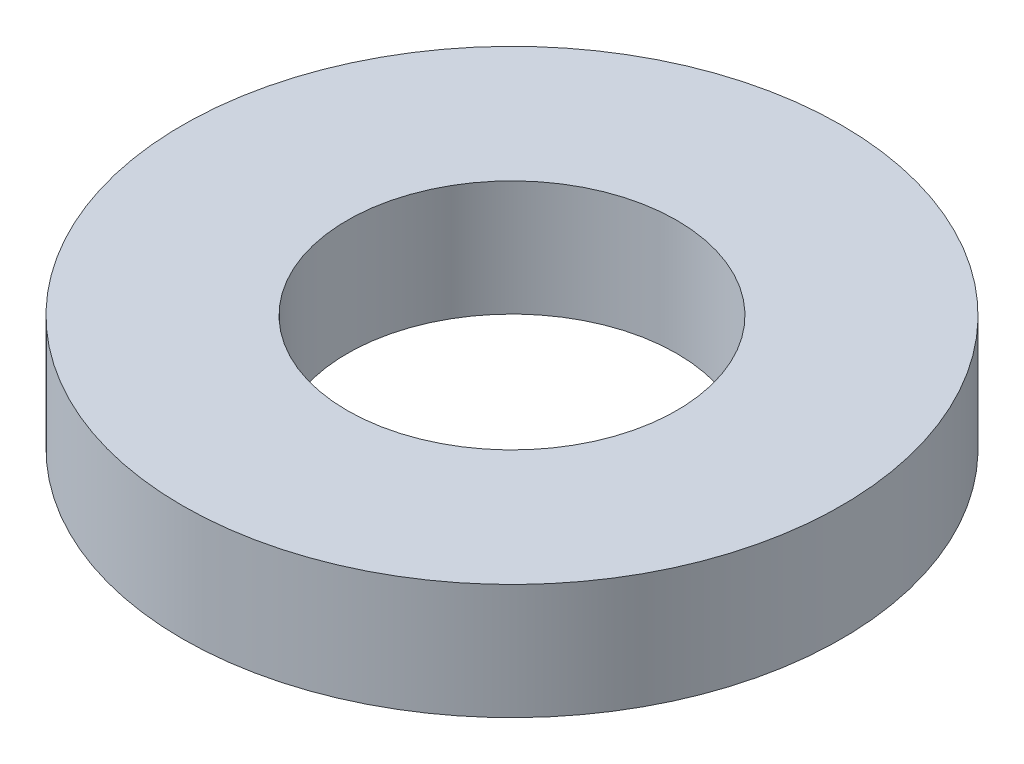
from build123d import *

# Parameters (mm, degrees)
SKETCH1_R           = 80
BOSS_EXTRUDE1_DEPTH = 28
SKETCH2_R           = 40
CUT_EXTRUDE1_DEPTH  = 117.550418275


with BuildPart() as part:
    # Sketch1 → Boss-Extrude1 (new body)
    with BuildSketch(Plane(origin=(0, 0, 0), x_dir=(1, 0, 0), z_dir=(0, 1, 0))):
        Circle(SKETCH1_R)
    extrude(amount=BOSS_EXTRUDE1_DEPTH)

    # Sketch2 → Cut-Extrude1 (cut, through all)
    with BuildSketch(Plane(origin=(0, 0, 0), x_dir=(1, 0, 0), z_dir=(0, 1, 0))):
        Circle(SKETCH2_R)
    extrude(amount=CUT_EXTRUDE1_DEPTH, mode=Mode.SUBTRACT)


solid = part.part
